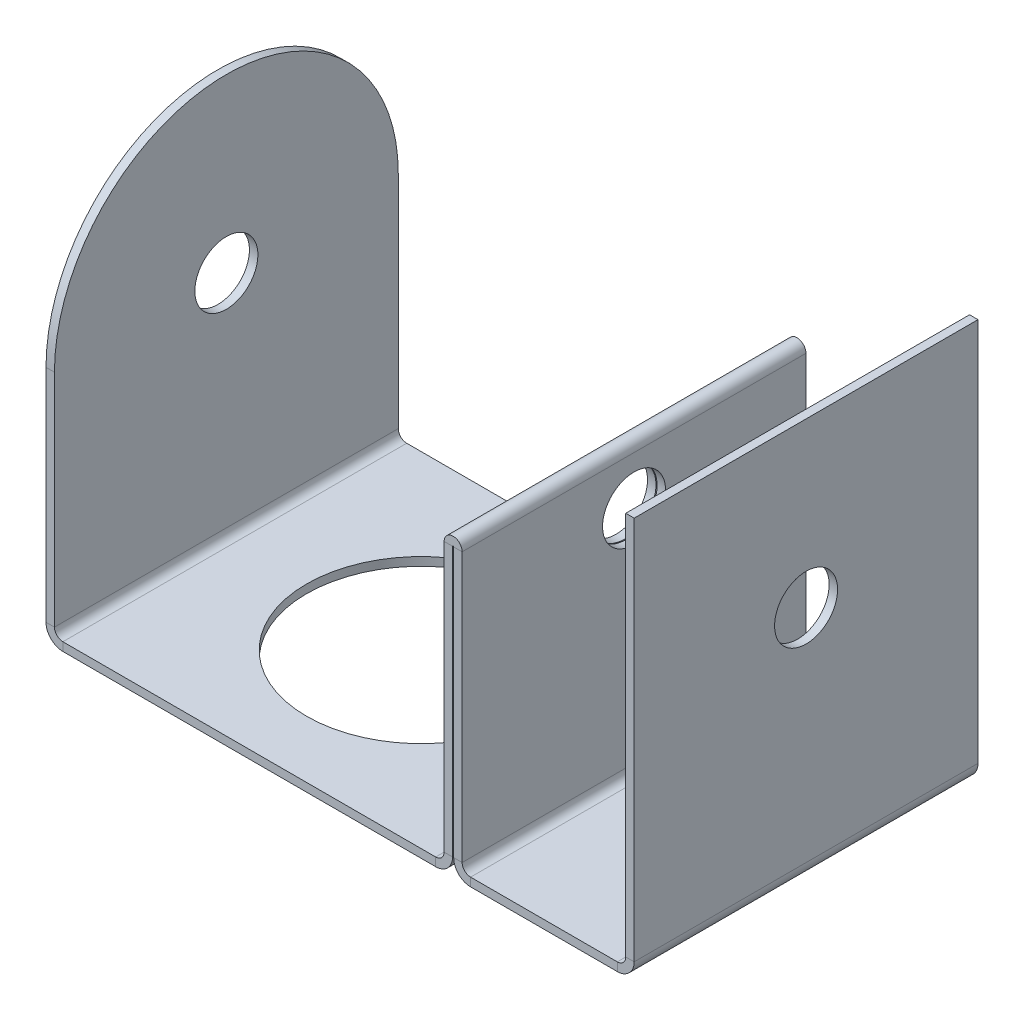
from build123d import *

# Parameters (mm, degrees)
SKETCH1_W                    = 34
SKETCH1_H                    = 30
SKETCH1_R                    = 10
BASE_FLANGE1_DEPTH           = 0.7366
EDGE_FLANGE1_STRIP_W         = 4.4196
EDGE_FLANGE1_STRIP_H         = 0.7366
EDGE_FLANGE1_STRIP_CUT_DEPTH = 30
EDGE_FLANGE1_DEPTH           = 30
EDGE_FLANGE2_STRIP_W         = 4.4196
EDGE_FLANGE2_STRIP_H         = 0.7366
EDGE_FLANGE2_STRIP_CUT_DEPTH = 30
EDGE_FLANGE2_DEPTH           = 30
EDGE_FLANGE2_START           = 0.7366
EDGE_FLANGE2_FLAT_DEPTH      = 0.7366
HEM1_START                   = -15
HEM1_DEPTH                   = 30
HEM1_2_DEPTH                 = 30
EDGE_FLANGE3_STRIP_W         = 4.4196
EDGE_FLANGE3_STRIP_H         = 0.7366
EDGE_FLANGE3_STRIP_CUT_DEPTH = 30
EDGE_FLANGE3_DEPTH           = 30
EDGE_FLANGE4_STRIP_W         = 4.4196
EDGE_FLANGE4_STRIP_H         = 0.7366
EDGE_FLANGE4_STRIP_CUT_DEPTH = 30
EDGE_FLANGE4_DEPTH           = 30
F_5_5_5_5_DIAMETER_HOLE1_D   = 5.5


# Read off the part's stored shape, not the designer's step: Hem1
# Sheet-metal steps are written as plain solids
with BuildPart() as part:
    # Sketch1 → Base-Flange1 (new body)
    with BuildSketch(Plane(origin=(0, 0, 0), x_dir=(1, 0, 0), z_dir=(0, 1, 0))):
        Rectangle(SKETCH1_W, SKETCH1_H)
        with Locations(Location((0, 0, 0), (0, 0, 270))):
            Circle(SKETCH1_R, mode=Mode.SUBTRACT)
    extrude(amount=-BASE_FLANGE1_DEPTH)

    # Edge-Flange1 strip (across the edge) → Edge-Flange1 strip cut (cut)
    with BuildSketch(Plane(origin=(17, 0, 15), x_dir=(-1, 0, 0), z_dir=(0, 0, -1))):
        with Locations((-1.4732, -0.3683)):
            Rectangle(EDGE_FLANGE1_STRIP_W, EDGE_FLANGE1_STRIP_H)
    extrude(amount=EDGE_FLANGE1_STRIP_CUT_DEPTH, mode=Mode.SUBTRACT)

    # Edge-Flange1 section (across the edge) → Edge-Flange1 (add)
    with BuildSketch(Plane(origin=(17, 0, 15), x_dir=(-1, 0, 0), z_dir=(0, 0, -1))):
        with BuildLine():
            Line((-0.7366, 0.7366), (-0.7366, 25))
            Line((-0.7366, 25), (0, 25))
            Line((0, 25), (0, 0.7366))
            ThreePointArc((0, 0.7366), (0.215745145, 0.215745145), (0.7366, 0))
            Line((0.7366, 0), (0.7366, -0.7366))
            ThreePointArc((0.7366, -0.7366), (-0.30510971, -0.30510971), (-0.7366, 0.7366))
        make_face()
    extrude(amount=EDGE_FLANGE1_DEPTH)

    # Edge-Flange2 strip (across the edge) → Edge-Flange2 strip cut (cut)
    with BuildSketch(Plane(origin=(-17, 0, -15), x_dir=(1, 0, 0), z_dir=(0, 0, 1))):
        with Locations((-1.4732, -0.3683)):
            Rectangle(EDGE_FLANGE2_STRIP_W, EDGE_FLANGE2_STRIP_H)
    extrude(amount=EDGE_FLANGE2_STRIP_CUT_DEPTH, mode=Mode.SUBTRACT)

    # Edge-Flange2 bend section (across the edge) → Edge-Flange2 (add)
    with BuildSketch(Plane(origin=(-17, 0, -15), x_dir=(1, 0, 0), z_dir=(0, 0, 1))):
        with BuildLine():
            Line((-0.7366, 0.7366), (0, 0.7366))
            ThreePointArc((0, 0.7366), (0.215745145, 0.215745145), (0.7366, 0))
            Line((0.7366, 0), (0.7366, -0.7366))
            ThreePointArc((0.7366, -0.7366), (-0.30510971, -0.30510971), (-0.7366, 0.7366))
        make_face()
    extrude(amount=EDGE_FLANGE2_DEPTH)

    # Edge-Flange2 profile (on flange) → Edge-Flange2 flat (add)
    with BuildSketch(Plane.ZY.offset(17).offset(EDGE_FLANGE2_START)):
        with BuildLine():
            ThreePointArc((15, 20), (0, 35), (-15, 20))
            Line((-15, 20), (-15, 0.7366))
            Line((-15, 0.7366), (15, 0.7366))
            Line((15, 0.7366), (15, 20))
        make_face()
    extrude(amount=-EDGE_FLANGE2_FLAT_DEPTH)

    # Hem1 outline → Hem1 (cut)
    with BuildSketch(Plane.XY.offset(HEM1_START)):
        with BuildLine():
            ThreePointArc((17, 24.2134), (17.212984467, 24.751642306), (17.7366, 24.998409274))
            Line((17.7366, 24.998409274), (17.7366, 25))
            Line((17.7366, 25), (17, 25))
            Line((17, 25), (17, 24.2134))
        make_face()
    extrude(amount=HEM1_DEPTH, mode=Mode.SUBTRACT)

    # Hem1 2 outline → Hem1 2 (add)
    with BuildSketch(Plane.XY.offset(HEM1_START)):
        with BuildLine():
            Line((17.8366, -0.7366), (18.5732, -0.7366))
            Line((18.5732, -0.7366), (18.5732, 24.2134))
            ThreePointArc((18.5732, 24.2134), (18.324842306, 24.787015533), (17.7366, 24.998409274))
            Line((17.7366, 24.998409274), (17.7366, 24.2134))
            ThreePointArc((17.7366, 24.2134), (17.7866, 24.2634), (17.8366, 24.2134))
            Line((17.8366, 24.2134), (17.8366, -0.7366))
        make_face()
    extrude(amount=HEM1_2_DEPTH)

    # Edge-Flange3 strip (across the edge) → Edge-Flange3 strip cut (cut)
    with BuildSketch(Plane(origin=(18.5732, -0.7366, 15), x_dir=(0, 1, 0), z_dir=(0, 0, -1))):
        with Locations((-0.7366, -0.3683)):
            Rectangle(EDGE_FLANGE3_STRIP_W, EDGE_FLANGE3_STRIP_H)
    extrude(amount=EDGE_FLANGE3_STRIP_CUT_DEPTH, mode=Mode.SUBTRACT)

    # Edge-Flange3 section (across the edge) → Edge-Flange3 (add)
    with BuildSketch(Plane(origin=(18.5732, -0.7366, 15), x_dir=(0, 1, 0), z_dir=(0, 0, -1))):
        with BuildLine():
            Line((0, 0.7366), (0, 14.2734))
            Line((0, 14.2734), (0.7366, 14.2734))
            Line((0.7366, 14.2734), (0.7366, 0.7366))
            ThreePointArc((0.7366, 0.7366), (0.952345145, 0.215745145), (1.4732, 0))
            Line((1.4732, 0), (1.4732, -0.7366))
            ThreePointArc((1.4732, -0.7366), (0.43149029, -0.30510971), (0, 0.7366))
        make_face()
    extrude(amount=EDGE_FLANGE3_DEPTH)

    # Edge-Flange4 strip (across the edge) → Edge-Flange4 strip cut (cut)
    with BuildSketch(Plane(origin=(32.8466, 0, 15), x_dir=(-1, 0, 0), z_dir=(0, 0, -1))):
        with Locations((-1.4732, -0.3683)):
            Rectangle(EDGE_FLANGE4_STRIP_W, EDGE_FLANGE4_STRIP_H)
    extrude(amount=EDGE_FLANGE4_STRIP_CUT_DEPTH, mode=Mode.SUBTRACT)

    # Edge-Flange4 section (across the edge) → Edge-Flange4 (add)
    with BuildSketch(Plane(origin=(32.8466, 0, 15), x_dir=(-1, 0, 0), z_dir=(0, 0, -1))):
        with BuildLine():
            Line((-0.7366, 0.7366), (-0.7366, 34.2634))
            Line((-0.7366, 34.2634), (0, 34.2634))
            Line((0, 34.2634), (0, 0.7366))
            ThreePointArc((0, 0.7366), (0.215745145, 0.215745145), (0.7366, 0))
            Line((0.7366, 0), (0.7366, -0.7366))
            ThreePointArc((0.7366, -0.7366), (-0.30510971, -0.30510971), (-0.7366, 0.7366))
        make_face()
    extrude(amount=EDGE_FLANGE4_DEPTH)

    # Ø5.5 (5.5) Diameter Hole1 (through all)
    with Locations(Plane.ZY.offset(17.7366)):
        with Locations((0, 20)):
            Hole(F_5_5_5_5_DIAMETER_HOLE1_D / 2)


solid = part.part
